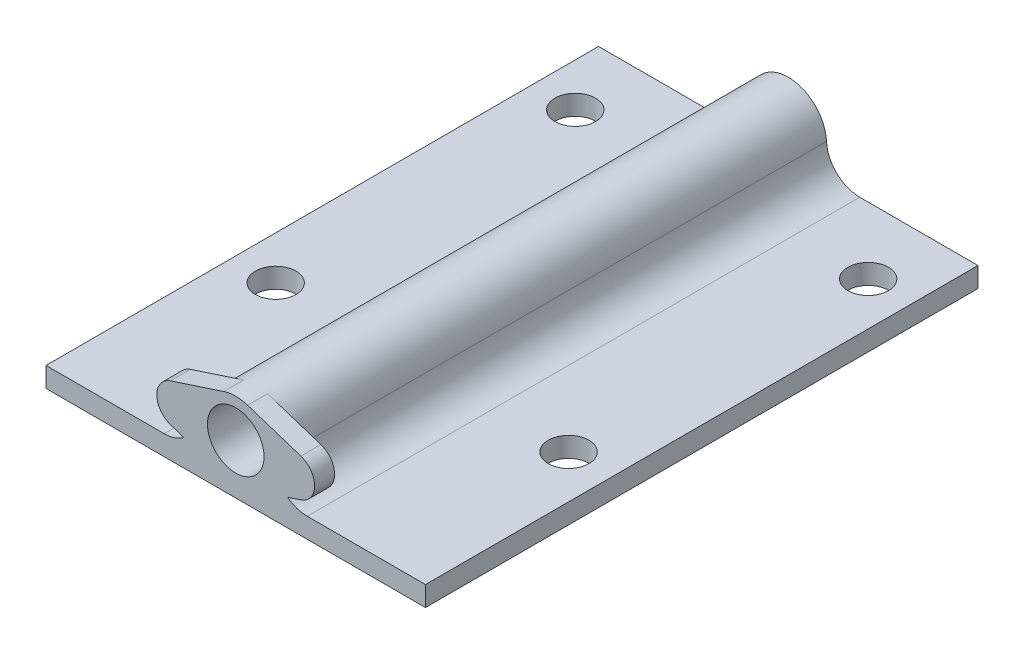
from build123d import *

# Parameters (mm, degrees)
ESQUISSE1_R        = 4.25
BOSS_EXTRU_1_DEPTH = 1.5
ESQUISSE1_2_R      = 5.75
ESQUISSE1_2_R_2    = 4.25
EXTRU_MINCE1_DEPTH = 80
ESQUISSE2_R        = 5.75
ESQUISSE2_R_2      = 4.25
BOSS_EXTRU_2_DEPTH = 3
ESQUISSE4_W        = 57
ESQUISSE4_H        = 83
ESQUISSE4_R        = 3.05
BOSS_EXTRU_3_DEPTH = 3
CONG_1_R           = 5


with BuildPart() as part:
    # Esquisse1 → Boss.-Extru.1 (new body)
    with BuildSketch(Plane.XY):
        Circle(ESQUISSE1_R)
    extrude(amount=BOSS_EXTRU_1_DEPTH)

    # Esquisse1<2> → Extru.-Mince1 (add)
    with BuildSketch(Plane.XY):
        Circle(ESQUISSE1_2_R)
        Circle(ESQUISSE1_2_R_2, mode=Mode.SUBTRACT)
    extrude(amount=EXTRU_MINCE1_DEPTH)

    # Esquisse2 → Boss.-Extru.2 (add)
    # profile 1 of 3: a face of its own
    with BuildSketch(Plane.XY.offset(80)):
        with BuildLine():
            Line((9.78589137, 2.851632123), (1.78589137, 5.465628236))
            ThreePointArc((1.78589137, 5.465628236), (4.654641521, 3.375916514), (5.75, 0))
            ThreePointArc((5.75, 0), (4.654641521, -3.375916514), (1.78589137, -5.465628236))
            Line((1.78589137, -5.465628236), (9.78589137, -2.851632123))
            ThreePointArc((9.78589137, -2.851632123), (11.282630579, -1.761347746), (11.85412196, 0))
            ThreePointArc((11.85412196, 0), (11.282630579, 1.761347746), (9.78589137, 2.851632123))
        make_face()
    # profile 2 of 3: a face of its own
    with BuildSketch(Plane.XY.offset(80)):
        with BuildLine():
            ThreePointArc((-1.78589137, -5.465628236), (-5.75, 0), (-1.78589137, 5.465628236))
            Line((-1.78589137, 5.465628236), (-9.78589137, 2.851632123))
            ThreePointArc((-9.78589137, 2.851632123), (-11.282630579, 1.761347746), (-11.85412196, 0))
            ThreePointArc((-11.85412196, 0), (-11.282630579, -1.761347746), (-9.78589137, -2.851632123))
            Line((-9.78589137, -2.851632123), (-1.78589137, -5.465628236))
        make_face()
    # profile 3 of 3: a face of its own
    with BuildSketch(Plane.XY.offset(80)):
        with Locations(Location((0, 0, 0), (0, 0, 108.094778376))):
            Circle(ESQUISSE2_R)
        Circle(ESQUISSE2_R_2, mode=Mode.SUBTRACT)
    extrude(amount=BOSS_EXTRU_2_DEPTH)

    # Esquisse4 → Boss.-Extru.3 (add)
    with BuildSketch(Plane(origin=(0, -4.5, 0), x_dir=(1, 0, 0), z_dir=(0, 1, 0))):
        with Locations((0, -41.5)):
            Rectangle(ESQUISSE4_W, ESQUISSE4_H)
        with Locations(Location((22, -55, 0), (0, 0, 270))):
            Circle(ESQUISSE4_R, mode=Mode.SUBTRACT)
        with Locations(Location((-22, -55, 0), (0, 0, 270))):
            Circle(ESQUISSE4_R, mode=Mode.SUBTRACT)
        with Locations(Location((-22, -10, 0), (0, 0, 270))):
            Circle(ESQUISSE4_R, mode=Mode.SUBTRACT)
        with Locations(Location((22, -10, 0), (0, 0, 270))):
            Circle(ESQUISSE4_R, mode=Mode.SUBTRACT)
    extrude(amount=-BOSS_EXTRU_3_DEPTH)

    # Congé1
    # the kernel refuses this fillet: 5 mm, written as the material it adds along each edge
    with BuildSketch(Plane(origin=(3.579455266, -4.5, 97.897276329), x_dir=(0.4133759504867887, 0.9105604447586902, 0), z_dir=(0, 0, -1))) as cong_1_piece_1_section:
        with BuildLine():
            CenterArc((7.512123669, 4.451741005), CONG_1_R, 155.582916087, 87.334118235)
            Line((2.959321445, 6.518620758), (0, 0))
            ThreePointArc((0, 0), (2.617861279, 0.630497844), (5.235722557, 0))
        make_face()
    cong_1_piece_1 = extrude(amount=97.897276329, mode=Mode.PRIVATE)
    cong_1_piece_1 = split(cong_1_piece_1, bisect_by=Plane(origin=(6.241297516, -3.427571976, 83), z_dir=(0, 0, -1)), keep=Keep.TOP, mode=Mode.PRIVATE)
    add(cong_1_piece_1)
    with BuildSketch(Plane(origin=(-3.579455266, -4.5, 97.897276329), x_dir=(-0.41337595048678866, 0.9105604447586904, 0), z_dir=(0, 0, -1))) as cong_1_piece_2_section:
        with BuildLine():
            CenterArc((7.512123669, -4.451741005), CONG_1_R, 117.082965678, 87.334118235)
            Line((2.959321445, -6.518620758), (0, 0))
            ThreePointArc((0, 0), (2.617861279, -0.630497844), (5.235722557, 0))
        make_face()
    cong_1_piece_2 = extrude(amount=97.897276329, mode=Mode.PRIVATE)
    cong_1_piece_2 = split(cong_1_piece_2, bisect_by=Plane(origin=(-6.241297516, -3.427571976, 83), z_dir=(0, 0, -1)), keep=Keep.TOP, mode=Mode.PRIVATE)
    add(cong_1_piece_2)


solid = part.part
